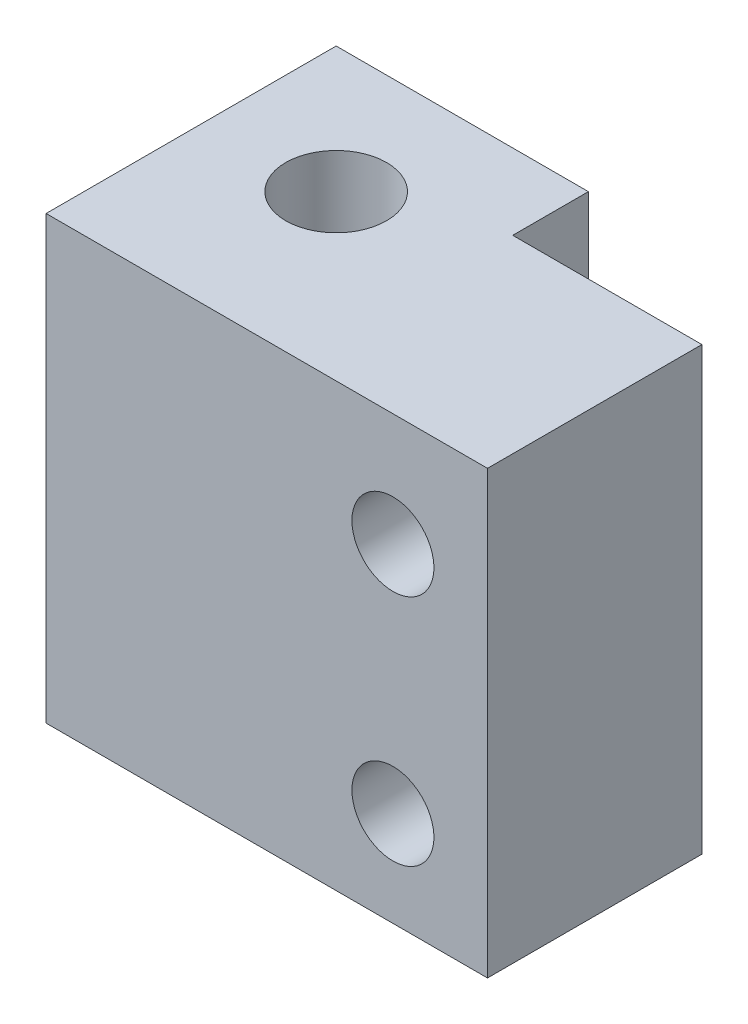
from build123d import *

# Parameters (mm, degrees)
BOSS_EXTRUDE2_DEPTH = 35
CUT_EXTRUDE1_REACH  = 50.429
SKETCH3_R           = 4
CUT_EXTRUDE2_REACH  = 48.249
SKETCH4_R           = 3.25


with BuildPart() as part:
    # Sketch1 → Boss-Extrude2 (new body)
    with BuildSketch(Plane(origin=(0, 0, 0), x_dir=(1, 0, 0), z_dir=(0, 1, 0))):
        Polygon((-10, -5.257459708), (-10, 0.742540292), (10, 0.742540292), (10, -5.257459708), (25, -5.257459708), (25, -22.257459708), (-10, -22.257459708), align=None)
    extrude(amount=BOSS_EXTRUDE2_DEPTH)

    # Sketch3 → Cut-Extrude1 (cut, up to next)
    with BuildSketch(Plane.XZ, mode=Mode.PRIVATE) as cut_extrude1_sk1:
        with Locations((0, 9.257459708)):
            Circle(SKETCH3_R)
    cut_extrude1_tool1 = extrude(cut_extrude1_sk1.sketch, amount=-CUT_EXTRUDE1_REACH, mode=Mode.PRIVATE) & part.part
    add(cut_extrude1_tool1.solids().sort_by_distance((0, 0, 9.25746))[0], mode=Mode.SUBTRACT)

    # Sketch4 → Cut-Extrude2 (cut, up to next)
    with BuildSketch(Plane(origin=(0, 0, 5.257459708), x_dir=(-1, 0, 0), z_dir=(0, 0, -1)), mode=Mode.PRIVATE) as cut_extrude2_sk1:
        with Locations((-17.5, 26.045770547)):
            Circle(SKETCH4_R)
    cut_extrude2_tool1 = extrude(cut_extrude2_sk1.sketch, amount=-CUT_EXTRUDE2_REACH, mode=Mode.PRIVATE) & part.part
    # Sketch4 → Cut-Extrude2 (cut, up to next)
    with BuildSketch(Plane(origin=(0, 0, 5.257459708), x_dir=(-1, 0, 0), z_dir=(0, 0, -1)), mode=Mode.PRIVATE) as cut_extrude2_sk2:
        with Locations((-17.5, 7.535290978)):
            Circle(SKETCH4_R)
    cut_extrude2_tool2 = extrude(cut_extrude2_sk2.sketch, amount=-CUT_EXTRUDE2_REACH, mode=Mode.PRIVATE) & part.part
    add(cut_extrude2_tool1.solids().sort_by_distance((17.5, 26.045771, 5.25746))[0], mode=Mode.SUBTRACT)
    add(cut_extrude2_tool2.solids().sort_by_distance((17.5, 7.535291, 5.25746))[0], mode=Mode.SUBTRACT)


solid = part.part
